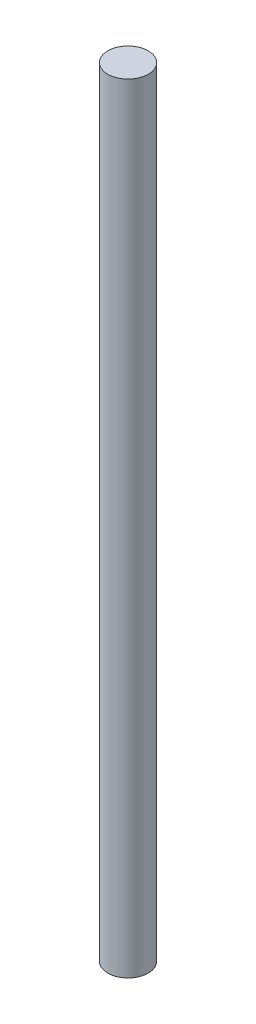
from build123d import *

# Parameters (mm, degrees)
SKETCH1_R           = 3.96875
BOSS_EXTRUDE1_DEPTH = 152.4


with BuildPart() as part:
    # Sketch1 → Boss-Extrude1 (new body)
    with BuildSketch(Plane(origin=(0, 0, 0), x_dir=(1, 0, 0), z_dir=(0, 1, 0))):
        Circle(SKETCH1_R)
    extrude(amount=BOSS_EXTRUDE1_DEPTH)


solid = part.part
